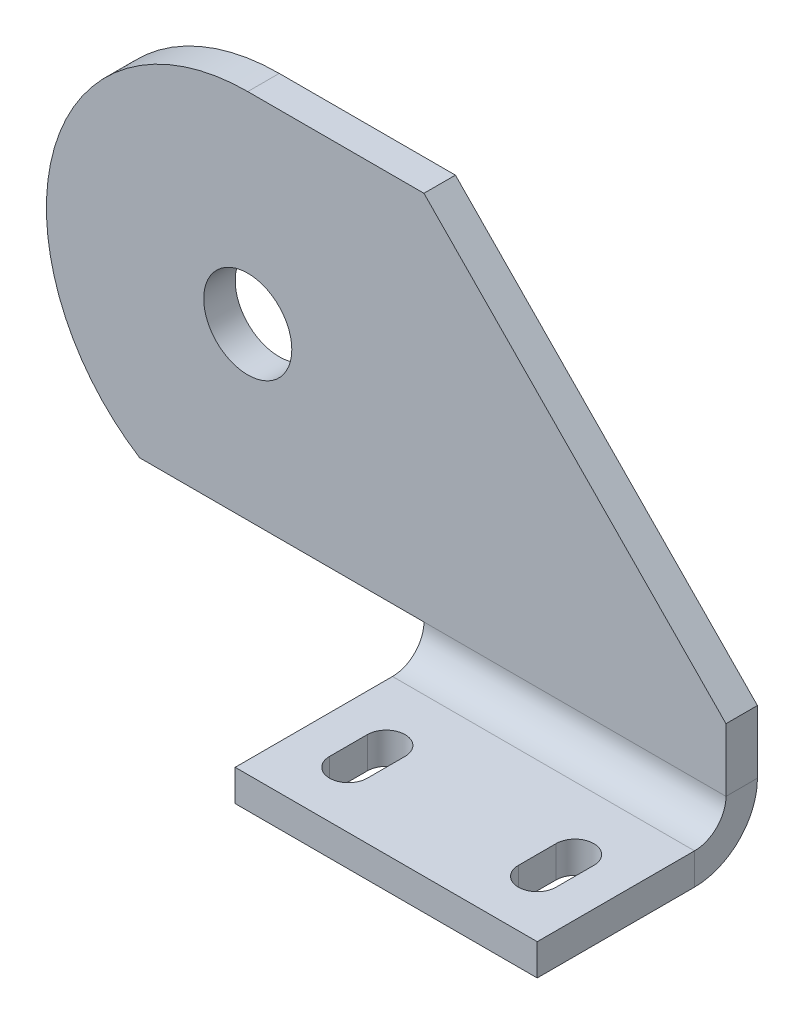
from build123d import *

# Parameters (mm, degrees)
T_LE_DE_BASE_PLI_E1_DEPTH    = 108
ESQUISSE2_W                  = 60
ESQUISSE2_H                  = 10
ENL_V_MAT_EXTRU_1_DEPTH      = 131.326513036
ENL_V_MAT_EXTRU_2_DEPTH      = 10
ENL_V_MAT_EXTRU_3_DEPTH      = 3
ENL_V_MAT_EXTRU_3_DEPTH_BACK = 130.073622402
ENL_V_MAT_EXTRU_4_DEPTH      = 10
ESQUISSE6_R                  = 7
ENL_V_MAT_EXTRU_5_DEPTH      = 10


# Sheet-metal steps are written as plain solids
with BuildPart() as part:
    # Esquisse1 → Tôle de base pliée1 (new body)
    with BuildSketch(Plane.ZY):
        with BuildLine():
            Line((30, 0), (5, 0))
            ThreePointArc((5, 0), (1.464466094, 1.464466094), (0, 5))
            Line((0, 5), (0, 64))
            Line((0, 64), (-5, 64))
            Line((-5, 64), (-5, 5))
            ThreePointArc((-5, 5), (-2.071067812, -2.071067812), (5, -5))
            Line((5, -5), (30, -5))
            Line((30, -5), (30, 0))
        make_face()
    extrude(amount=T_LE_DE_BASE_PLI_E1_DEPTH)

    # Esquisse2 → Enlèv. mat.-Extru.1 (cut, through all)
    with BuildSketch(Plane.XY.offset(30)):
        with Locations((-78, 0)):
            Rectangle(ESQUISSE2_W, ESQUISSE2_H)
    extrude(amount=-ENL_V_MAT_EXTRU_1_DEPTH, mode=Mode.SUBTRACT)

    # Esquisse3 → Enlèv. mat.-Extru.2 (cut)
    with BuildSketch(Plane.XY):
        with BuildLine():
            Line((-76, 64), (-123.136026385, 64))
            Line((-123.136026385, 64), (-123.136026385, 0))
            Line((-123.136026385, 0), (-76, 0))
            ThreePointArc((-76, 0), (-108, 32), (-76, 64))
        make_face()
    extrude(amount=-ENL_V_MAT_EXTRU_2_DEPTH, mode=Mode.SUBTRACT)

    # Esquisse4 → Enlèv. mat.-Extru.3 (cut, two sides: drawn at the far end of the back side and taken through both)
    with BuildSketch(Plane.XY.offset(-ENL_V_MAT_EXTRU_3_DEPTH_BACK)):
        Polygon((172.979910748, -161.583658888), (0, 15), (-48, 64), (-220.979910748, 240.583658888), (132.187407029, 586.543480383), (526.147228524, 184.376162607), align=None)
    extrude(amount=ENL_V_MAT_EXTRU_3_DEPTH + ENL_V_MAT_EXTRU_3_DEPTH_BACK, mode=Mode.SUBTRACT)

    # Esquisse5 → Enlèv. mat.-Extru.4 (cut)
    with BuildSketch(Plane(origin=(0, 0, 0), x_dir=(1, 0, 0), z_dir=(0, 1, 0))):
        with BuildLine():
            Line((-36, -15), (-36, -21))
            ThreePointArc((-36, -21), (-39, -24), (-42, -21))
            Line((-42, -21), (-42, -15))
            ThreePointArc((-42, -15), (-39, -12), (-36, -15))
        make_face()
        with BuildLine():
            Line((-6, -15), (-6, -21))
            ThreePointArc((-6, -21), (-9, -24), (-12, -21))
            Line((-12, -21), (-12, -15))
            ThreePointArc((-12, -15), (-9, -12), (-6, -15))
        make_face()
    extrude(amount=-ENL_V_MAT_EXTRU_4_DEPTH, mode=Mode.SUBTRACT)

    # Esquisse6 → Enlèv. mat.-Extru.5 (cut)
    with BuildSketch(Plane.XY):
        with Locations((-76, 32)):
            Circle(ESQUISSE6_R)
    extrude(amount=-ENL_V_MAT_EXTRU_5_DEPTH, mode=Mode.SUBTRACT)


solid = part.part
